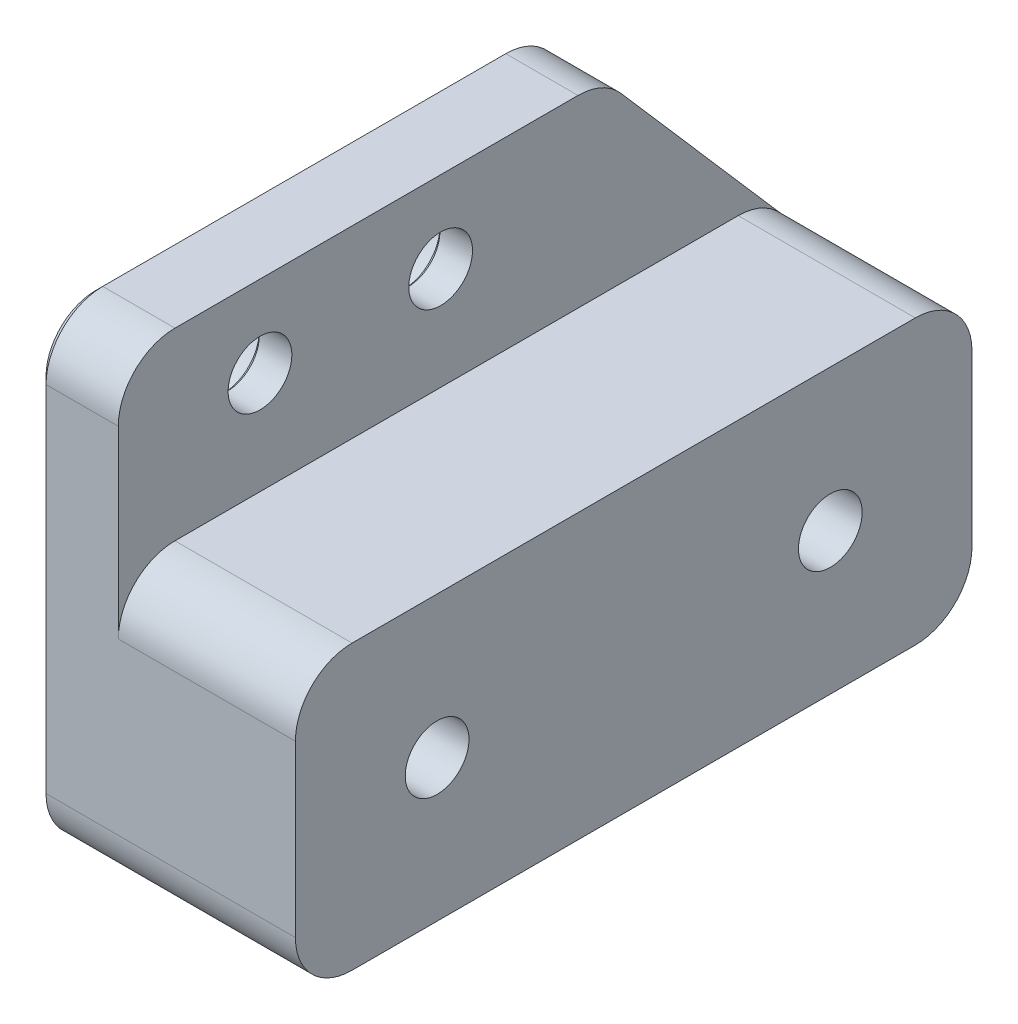
from build123d import *

# Parameters (mm, degrees)
SKETCH1_R           = 2.25
BOSS_EXTRUDE1_DEPTH = 2.6
BOSS_EXTRUDE3_START = -3
SKETCH3_R           = 3.75
BOSS_EXTRUDE3_DEPTH = 3
CHAMFER2_SIZE       = 0.3
CHAMFER3_SIZE       = 0.5
SKETCH4_R           = 2.25
BOSS_EXTRUDE4_DEPTH = 12.5


with BuildPart() as part:
    # Sketch1 → Boss-Extrude1 (new body)
    with BuildSketch(Plane(origin=(0, 0, 0), x_dir=(0, 0, -1), z_dir=(1, 0, 0))):
        with BuildLine():
            Line((-6, -10), (33.75, -10))
            ThreePointArc((33.75, -10), (36.578427125, -8.828427125), (37.75, -6))
            Line((37.75, -6), (37.75, 6))
            ThreePointArc((37.75, 6), (37.496577662, 7.401126626), (36.768422089, 8.62471486))
            Line((36.768422089, 8.62471486), (25.464074263, 21.62471486))
            ThreePointArc((25.464074263, 21.62471486), (24.104136506, 22.63997661), (22.445652174, 23))
            Line((22.445652174, 23), (-6, 23))
            ThreePointArc((-6, 23), (-8.828427125, 21.828427125), (-10, 19))
            Line((-10, 19), (-10, -6))
            ThreePointArc((-10, -6), (-8.828427125, -8.828427125), (-6, -10))
        make_face()
        with Locations((27.75, 0)):
            Circle(SKETCH1_R, mode=Mode.SUBTRACT)
        with Locations((0, 17.25)):
            Circle(SKETCH1_R, mode=Mode.SUBTRACT)
        Circle(SKETCH1_R, mode=Mode.SUBTRACT)
        with Locations((12.75, 17.25)):
            Circle(SKETCH1_R, mode=Mode.SUBTRACT)
    extrude(amount=BOSS_EXTRUDE1_DEPTH)

    # Sketch3 → Boss-Extrude3 (add)
    with BuildSketch(Plane(origin=(0, 0, 0), x_dir=(0, 0, -1), z_dir=(1, 0, 0)).offset(BOSS_EXTRUDE3_START)):
        with BuildLine():
            Line((-6, -10), (33.75, -10))
            ThreePointArc((33.75, -10), (36.578427125, -8.828427125), (37.75, -6))
            Line((37.75, -6), (37.75, 6))
            ThreePointArc((37.75, 6), (37.496577662, 7.401126626), (36.768422089, 8.62471486))
            Line((36.768422089, 8.62471486), (25.464074263, 21.62471486))
            ThreePointArc((25.464074263, 21.62471486), (24.104136506, 22.63997661), (22.445652174, 23))
            Line((22.445652174, 23), (-6, 23))
            ThreePointArc((-6, 23), (-8.828427125, 21.828427125), (-10, 19))
            Line((-10, 19), (-10, -6))
            ThreePointArc((-10, -6), (-8.828427125, -8.828427125), (-6, -10))
        make_face()
        with Locations((27.75, 0)):
            Circle(SKETCH3_R, mode=Mode.SUBTRACT)
        Circle(SKETCH3_R, mode=Mode.SUBTRACT)
        with Locations((0, 17.25)):
            Circle(SKETCH3_R, mode=Mode.SUBTRACT)
        with Locations((12.75, 17.25)):
            Circle(SKETCH3_R, mode=Mode.SUBTRACT)
    extrude(amount=BOSS_EXTRUDE3_DEPTH)

    # Chamfer2
    chamfer2_edges = [part.edges().sort_by_distance(p)[0] for p in [
        (0, 0, -24),
        (0, 0, -25.5),
        (0, 0, 3.75),
        (0, 0, 2.25),
        (0, 17.25, 2.25),
        (0, 17.25, 3.75),
        (0, 17.25, -9),
        (0, 17.25, -10.5),
    ]]
    chamfer(chamfer2_edges, length=CHAMFER2_SIZE)

    # Chamfer3
    chamfer3_edges = [part.edges().sort_by_distance(p)[0] for p in [
        (-3, 0, 3.75),
        (-3, 6.5, 10),
        (-3, 21.828427125, 8.828427125),
        (-3, 23, -8.222826087),
        (-3, 0, -37.75),
        (-3, -8.828427125, -36.578427125),
        (-3, -10, -13.875),
        (-3, -8.828427125, 8.828427125),
        (-3, 0, -24),
        (-3, 17.25, 3.75),
        (-3, 7.401126626, -37.496577662),
        (-3, 15.12471486, -31.116248176),
        (-3, 22.63997661, -24.104136506),
        (-3, 17.25, -9),
    ]]
    chamfer(chamfer3_edges, length=CHAMFER3_SIZE)

    # Sketch4 → Boss-Extrude4 (add)
    with BuildSketch(Plane(origin=(2.6, 0, 0), x_dir=(0, 0, -1), z_dir=(1, 0, 0))):
        with BuildLine():
            Line((-6, -10), (33.75, -10))
            ThreePointArc((33.75, -10), (36.578427125, -8.828427125), (37.75, -6))
            Line((37.75, -6), (37.75, 6))
            ThreePointArc((37.75, 6), (36.578427125, 8.828427125), (33.75, 10))
            Line((33.75, 10), (-6, 10))
            ThreePointArc((-6, 10), (-8.828427125, 8.828427125), (-10, 6))
            Line((-10, 6), (-10, -6))
            ThreePointArc((-10, -6), (-8.828427125, -8.828427125), (-6, -10))
        make_face()
        Circle(SKETCH4_R, mode=Mode.SUBTRACT)
        with Locations((27.75, 0)):
            Circle(SKETCH4_R, mode=Mode.SUBTRACT)
    extrude(amount=BOSS_EXTRUDE4_DEPTH)


solid = part.part
